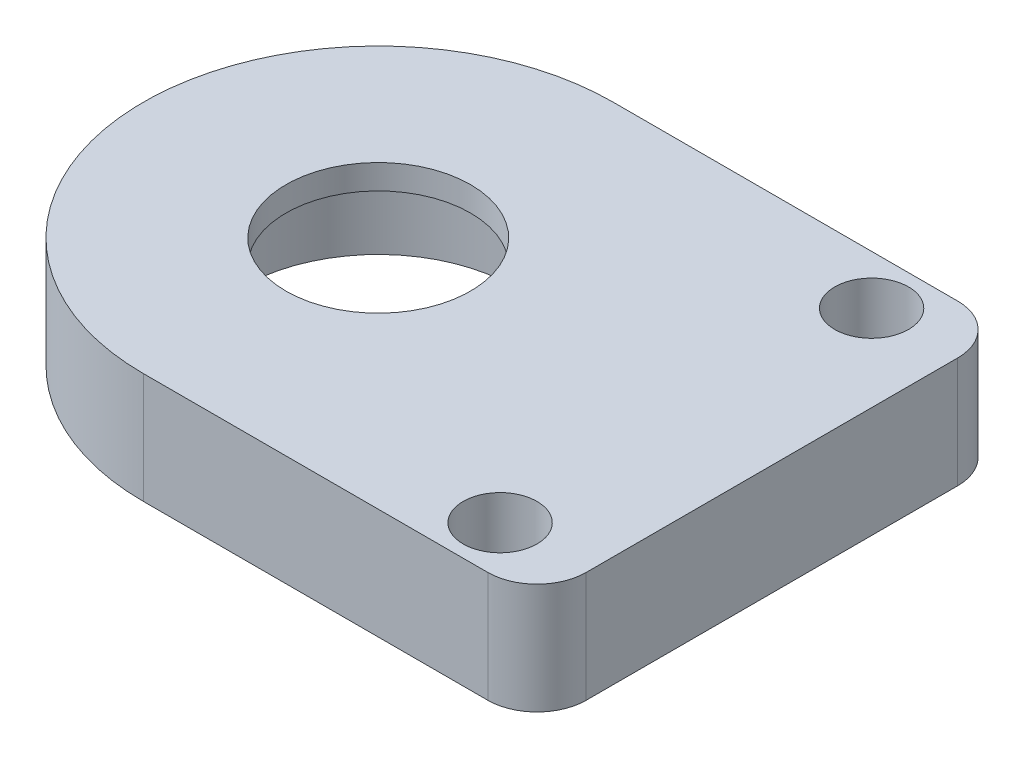
from build123d import *

# Parameters (mm, degrees)
SKIZZE1_R                       = 1.6
SKIZZE1_R_2                     = 11.075
AUFSATZ_LINEAR_AUSTRAGEN1_DEPTH = 7
SKIZZE3_R                       = 7.5
AUFSATZ_LINEAR_AUSTRAGEN2_DEPTH = 2
SKIZZE4_R                       = 3
SCHNITT_LINEAR_AUSTRAGEN1_DEPTH = 6.5
VERRUNDUNG4_R                   = 4


with BuildPart() as part:
    # Skizze1 → Aufsatz-Linear austragen1 (new body)
    with BuildSketch(Plane(origin=(0, 0, 0), x_dir=(1, 0, 0), z_dir=(0, 1, 0))):
        with BuildLine():
            Line((0, 19.098593171), (32, 19.098593171))
            Line((32, 19.098593171), (32, -19.098593171))
            Line((32, -19.098593171), (0, -19.098593171))
            ThreePointArc((0, -19.098593171), (-19.098593171, 0), (0, 19.098593171))
        make_face()
        with Locations((25, -15.098593171)):
            Circle(SKIZZE1_R, mode=Mode.SUBTRACT)
        with Locations((25, 15.098593171)):
            Circle(SKIZZE1_R, mode=Mode.SUBTRACT)
        Circle(SKIZZE1_R_2, mode=Mode.SUBTRACT)
    extrude(amount=AUFSATZ_LINEAR_AUSTRAGEN1_DEPTH)

    # Skizze3 → Aufsatz-Linear austragen2 (add)
    with BuildSketch(Plane(origin=(0, 7, 0), x_dir=(1, 0, 0), z_dir=(0, 1, 0))):
        with BuildLine():
            Line((0, 19.098593171), (32, 19.098593171))
            Line((32, 19.098593171), (32, -19.098593171))
            Line((32, -19.098593171), (0, -19.098593171))
            ThreePointArc((0, -19.098593171), (-19.098593171, 0), (0, 19.098593171))
        make_face()
        Circle(SKIZZE3_R, mode=Mode.SUBTRACT)
    extrude(amount=AUFSATZ_LINEAR_AUSTRAGEN2_DEPTH)

    # Skizze4 → Schnitt-Linear austragen1 (cut)
    with BuildSketch(Plane(origin=(0, 9, 0), x_dir=(1, 0, 0), z_dir=(0, 1, 0))):
        with Locations((25, 15.098593171)):
            Circle(SKIZZE4_R)
        with Locations((25, -15.098593171)):
            Circle(SKIZZE4_R)
    extrude(amount=-SCHNITT_LINEAR_AUSTRAGEN1_DEPTH, mode=Mode.SUBTRACT)

    # Verrundung4
    verrundung4_edges = [part.edges().sort_by_distance(p)[0] for p in [
        (32, 4.5, -19.098593171),
        (32, 4.5, 19.098593171),
    ]]
    fillet(verrundung4_edges, radius=VERRUNDUNG4_R)


solid = part.part
